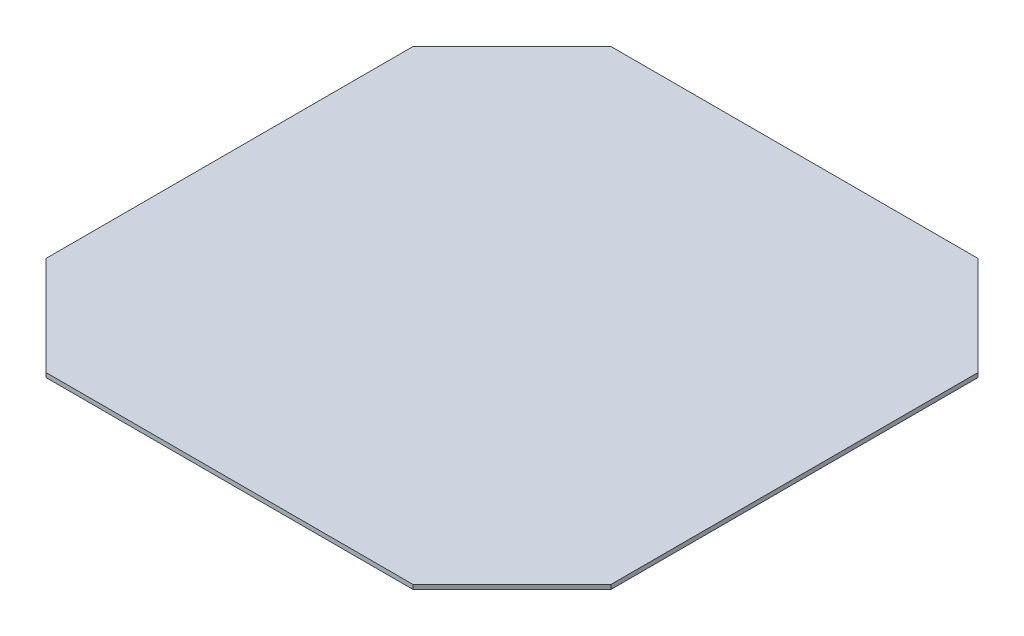
from build123d import *

# Parameters (mm, degrees)
SKETCH1_W            = 1231.9
SKETCH1_H            = 1231.9
BOSS_EXTRUDE1_DEPTH  = 9.525
CUT_EXTRUDE1_REACH   = 873.137
SKETCH2_R            = 152.4
CUT_EXTRUDE2_DEPTH   = 872.136918415
MIRROR2_COPY_1_DEPTH = 872.136918415


with BuildPart() as part:
    # Sketch1 → Boss-Extrude1 (new body)
    with BuildSketch(Plane(origin=(0, 0, 0), x_dir=(1, 0, 0), z_dir=(0, 1, 0))):
        Rectangle(SKETCH1_W, SKETCH1_H)
    extrude(amount=BOSS_EXTRUDE1_DEPTH)

    # Sketch2 → Cut-Extrude1 (cut, up to next)
    with BuildSketch(Plane(origin=(0, 9.525, 0), x_dir=(1, 0, 0), z_dir=(0, 1, 0)), mode=Mode.PRIVATE) as cut_extrude1_sk1:
        with Locations((-615.95, 615.95)):
            Circle(SKETCH2_R)
    cut_extrude1_tool1 = extrude(cut_extrude1_sk1.sketch, amount=-CUT_EXTRUDE1_REACH, mode=Mode.PRIVATE) & part.part
    # Sketch2 → Cut-Extrude1 (cut, up to next)
    with BuildSketch(Plane(origin=(0, 9.525, 0), x_dir=(1, 0, 0), z_dir=(0, 1, 0)), mode=Mode.PRIVATE) as cut_extrude1_sk2:
        with Locations((-615.95, -615.95)):
            Circle(SKETCH2_R)
    cut_extrude1_tool2 = extrude(cut_extrude1_sk2.sketch, amount=-CUT_EXTRUDE1_REACH, mode=Mode.PRIVATE) & part.part
    # Sketch2 → Cut-Extrude1 (cut, up to next)
    with BuildSketch(Plane(origin=(0, 9.525, 0), x_dir=(1, 0, 0), z_dir=(0, 1, 0)), mode=Mode.PRIVATE) as cut_extrude1_sk3:
        with Locations((615.95, -615.95)):
            Circle(SKETCH2_R)
    cut_extrude1_tool3 = extrude(cut_extrude1_sk3.sketch, amount=-CUT_EXTRUDE1_REACH, mode=Mode.PRIVATE) & part.part
    # Sketch2 → Cut-Extrude1 (cut, up to next)
    with BuildSketch(Plane(origin=(0, 9.525, 0), x_dir=(1, 0, 0), z_dir=(0, 1, 0)), mode=Mode.PRIVATE) as cut_extrude1_sk4:
        with Locations((615.95, 615.95)):
            Circle(SKETCH2_R)
    cut_extrude1_tool4 = extrude(cut_extrude1_sk4.sketch, amount=-CUT_EXTRUDE1_REACH, mode=Mode.PRIVATE) & part.part
    add(cut_extrude1_tool1.solids().sort_by_distance((-615.95, 9.525, -615.95))[0], mode=Mode.SUBTRACT)
    add(cut_extrude1_tool2.solids().sort_by_distance((-615.95, 9.525, 615.95))[0], mode=Mode.SUBTRACT)
    add(cut_extrude1_tool3.solids().sort_by_distance((615.95, 9.525, 615.95))[0], mode=Mode.SUBTRACT)
    add(cut_extrude1_tool4.solids().sort_by_distance((615.95, 9.525, -615.95))[0], mode=Mode.SUBTRACT)

    # Sketch3 → Cut-Extrude2 (cut, symmetric)
    with BuildSketch(Plane(origin=(0, 9.525, 0), x_dir=(1, 0, 0), z_dir=(0, 1, 0))):
        Polygon((-1865.227928021, 2881.601781116), (400.423853094, 615.95), (615.95, 400.423853094), (2881.601781116, -1865.227928021), (7412.905343347, 2666.07563421), (2666.07563421, 7412.905343347), align=None)
    cut_extrude2 = extrude(amount=CUT_EXTRUDE2_DEPTH, both=True, mode=Mode.SUBTRACT)

    # Mirror1: Cut-Extrude2 across plane
    add(cut_extrude2.mirror(Plane.XY), mode=Mode.SUBTRACT)

    # Mirror2: Cut-Extrude2 across plane
    add(cut_extrude2.mirror(Plane(origin=(0, 0, 0), x_dir=(0, 0, 1), z_dir=(1, 0, 0))), mode=Mode.SUBTRACT)

    # Mirror2 copy 1 sketch → Mirror2 copy 1 (cut, symmetric)
    with BuildSketch(Plane(origin=(0, 9.525, 0), x_dir=(-1, 0, 0), z_dir=(0, 1, 0))):
        Polygon((-1865.227928021, 2881.601781116), (400.423853094, 615.95), (615.95, 400.423853094), (2881.601781116, -1865.227928021), (7412.905343347, 2666.07563421), (2666.07563421, 7412.905343347), align=None)
    extrude(amount=MIRROR2_COPY_1_DEPTH, both=True, mode=Mode.SUBTRACT)


solid = part.part
